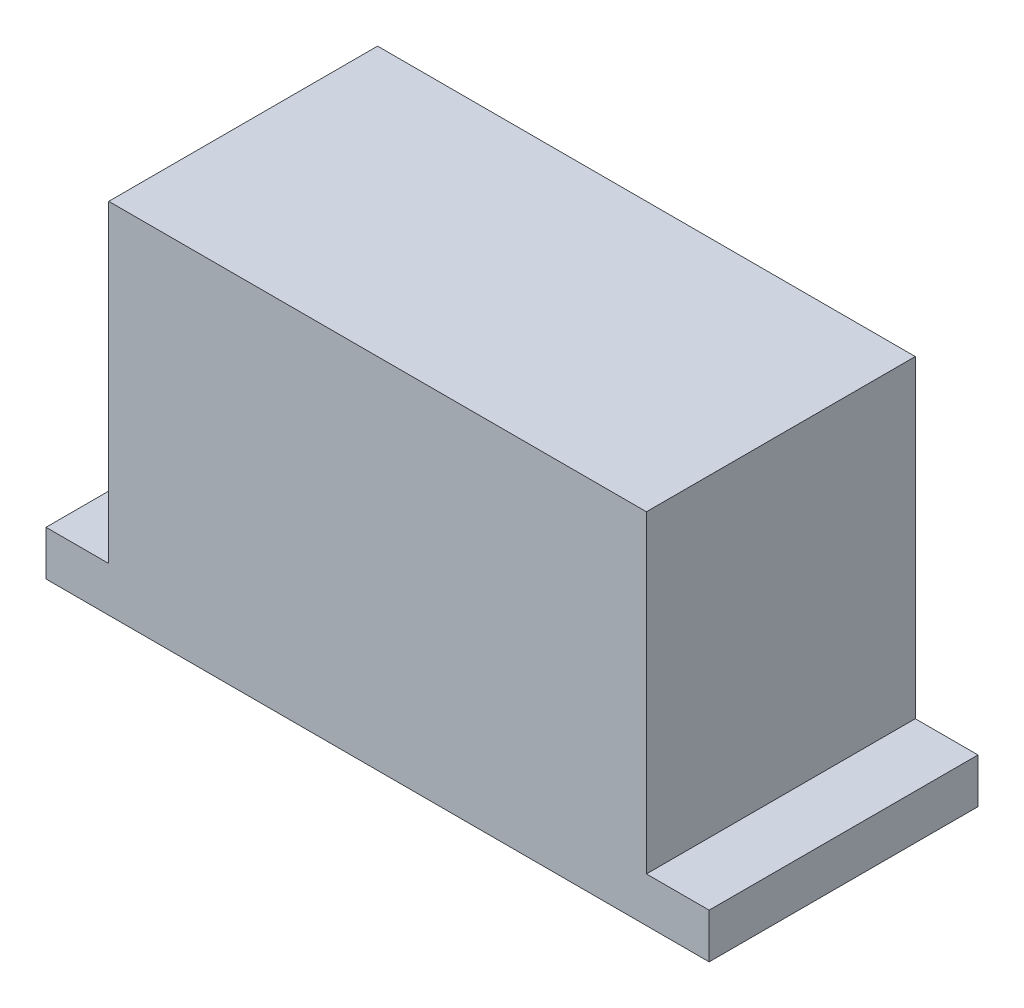
from build123d import *

# Parameters (mm, degrees)
SKETCH5_W           = 60
SKETCH5_H           = 30
BOSS_EXTRUDE3_DEPTH = 40
SKETCH7_W           = 40
SKETCH7_H           = 20
CUT_EXTRUDE1_DEPTH  = 15
FILLET1_R           = 3
FILLET2_R           = 3
FILLET3_R           = 3
FILLET4_R           = 3
SKETCH9_W           = 30
SKETCH9_H           = 5
BOSS_EXTRUDE4_DEPTH = 7
SKETCH10_W          = 30
SKETCH10_H          = 5
BOSS_EXTRUDE5_DEPTH = 7
SKETCH12_R          = 2
CUT_EXTRUDE2_DEPTH  = 10
SKETCH13_W          = 64
SKETCH13_H          = 20
CUT_EXTRUDE3_DEPTH  = 1.5


with BuildPart() as part:
    # Sketch5 → Boss-Extrude3 (new body)
    with BuildSketch(Plane(origin=(0, 0, 0), x_dir=(1, 0, 0), z_dir=(0, 1, 0))):
        Rectangle(SKETCH5_W, SKETCH5_H)
    extrude(amount=BOSS_EXTRUDE3_DEPTH)

    # Sketch7 → Cut-Extrude1 (cut)
    with BuildSketch(Plane(origin=(0, 0, -15), x_dir=(-1, 0, 0), z_dir=(0, 0, -1))):
        with Locations((0, 20)):
            Rectangle(SKETCH7_W, SKETCH7_H)
    extrude(amount=-CUT_EXTRUDE1_DEPTH, mode=Mode.SUBTRACT)

    # Fillet1
    fillet1_edges = [part.edges().sort_by_distance(p)[0] for p in [
        (20, 10, -7.5),
    ]]
    fillet(fillet1_edges, radius=FILLET1_R)

    # Fillet2
    fillet2_edges = [part.edges().sort_by_distance(p)[0] for p in [
        (-20, 10, -7.5),
    ]]
    fillet(fillet2_edges, radius=FILLET2_R)

    # Fillet3
    fillet3_edges = [part.edges().sort_by_distance(p)[0] for p in [
        (-20, 30, -7.5),
    ]]
    fillet(fillet3_edges, radius=FILLET3_R)

    # Fillet4
    fillet4_edges = [part.edges().sort_by_distance(p)[0] for p in [
        (20, 30, -7.5),
    ]]
    fillet(fillet4_edges, radius=FILLET4_R)

    # Sketch9 → Boss-Extrude4 (add)
    with BuildSketch(Plane.ZY.offset(30)):
        with Locations((0, 2.5)):
            Rectangle(SKETCH9_W, SKETCH9_H)
    extrude(amount=BOSS_EXTRUDE4_DEPTH)

    # Sketch10 → Boss-Extrude5 (add)
    with BuildSketch(Plane(origin=(30, 0, 0), x_dir=(0, 0, -1), z_dir=(1, 0, 0))):
        with Locations((0, 2.5)):
            Rectangle(SKETCH10_W, SKETCH10_H)
    extrude(amount=BOSS_EXTRUDE5_DEPTH)

    # Sketch12 → Cut-Extrude2 (cut)
    with BuildSketch(Plane.ZY.offset(30)):
        with Locations((-7.531524718, 22.710545663)):
            Circle(SKETCH12_R)
    extrude(amount=-CUT_EXTRUDE2_DEPTH, mode=Mode.SUBTRACT)

    # Sketch13 → Cut-Extrude3 (cut)
    with BuildSketch(Plane(origin=(0, 0, 0), x_dir=(-1, 0, 0), z_dir=(0, -1, 0))):
        Rectangle(SKETCH13_W, SKETCH13_H)
    extrude(amount=-CUT_EXTRUDE3_DEPTH, mode=Mode.SUBTRACT)


solid = part.part
